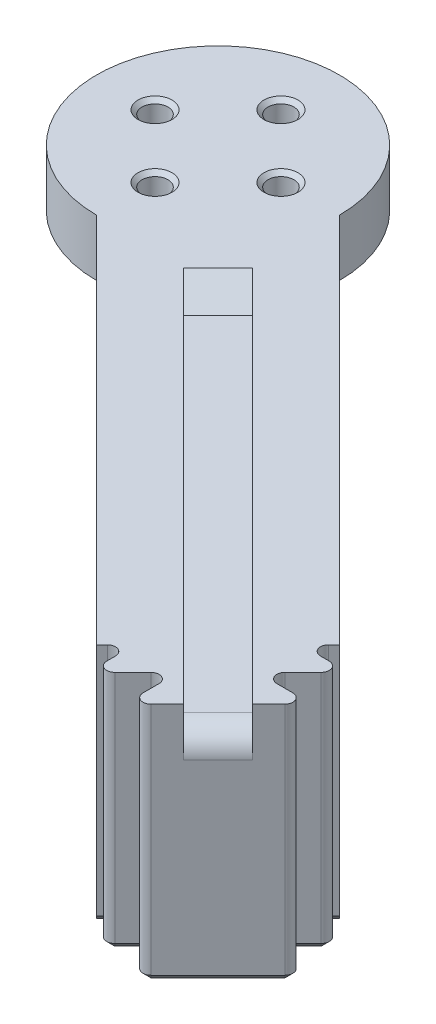
from build123d import *

# Parameters (mm, degrees)
BOSS_EXTRUDE1_DEPTH      = 10
SKETCH2_R                = 1.6
CUT_EXTRUDE1_DEPTH       = 10
BOSS_EXTRUDE4_DEPTH      = 1
BOSS_EXTRUDE5_DEPTH      = 21.213203436
BOSS_EXTRUDE6_DEPTH      = 30
FILLET3_R                = 1
CUT_EXTRUDE8_DEPTH       = 3
FILLET8_R                = 1
FILLET9_R                = 3
CHAMFER2_SIZE            = 3
CUT_EXTRUDE18_DEPTH      = 97.248328989
CUT_EXTRUDE18_DEPTH_BACK = 97.248328989
SKETCH21_W               = 30
SKETCH21_H               = 15.758887264
CHAMFER3_SIZE            = 3
CHAMFER4_SIZE            = 0.5
CHAMFER6_SIZE            = 1
SKETCH23_R               = 2
CUT_EXTRUDE19_DEPTH      = 3
CUT_EXTRUDE20_START      = -15
SKETCH24_R               = 2
CUT_EXTRUDE20_DEPTH      = 5
SKETCH25_R               = 3
CUT_EXTRUDE21_DEPTH      = 2
CUT_EXTRUDE22_DEPTH      = 94.615857044
CUT_EXTRUDE23_REACH      = 97.663
FILLET10_R               = 3
BOSS_EXTRUDE7_DEPTH      = 11.213203436
FILLET11_START           = -20
FILLET11_DEPTH           = 3.841689217
FILLET11_START_2         = 4.444783185
FILLET11_2_DEPTH         = 3.682043042
CHAMFER7_SIZE            = 1
FILLET12_R               = 3


with BuildPart() as part:
    # Sketch1 → Boss-Extrude1 (new body)
    with BuildSketch(Plane(origin=(0, 0, 0), x_dir=(1, 0, 0), z_dir=(0, 1, 0))):
        with BuildLine():
            Line((0, -15), (45.961940777, -60.961940777))
            Line((45.961940777, -60.961940777), (60.961940777, -45.961940777))
            Line((60.961940777, -45.961940777), (15, 0))
            ThreePointArc((15, 0), (-10.606601718, 10.606601718), (0, -15))
        make_face()
    extrude(amount=BOSS_EXTRUDE1_DEPTH)

    # Sketch2 → Cut-Extrude1 (cut)
    with BuildSketch(Plane(origin=(0, 10, 0), x_dir=(1, 0, 0), z_dir=(0, 1, 0))):
        with Locations(Location((-7.657178999, -0.123260765, 0), (0, 0, 270))):
            Circle(SKETCH2_R)
        with Locations(Location((0.120995594, 7.654913828, 0), (0, 0, 270))):
            Circle(SKETCH2_R)
        with Locations(Location((0.120995594, -7.901435358, 0), (0, 0, 270))):
            Circle(SKETCH2_R)
        with Locations(Location((7.899170187, -0.123260765, 0), (0, 0, 270))):
            Circle(SKETCH2_R)
    extrude(amount=-CUT_EXTRUDE1_DEPTH, mode=Mode.SUBTRACT)

    # Sketch4 → Boss-Extrude4 (add)
    with BuildSketch(Plane(origin=(0, 10, 0), x_dir=(1, 0, 0), z_dir=(0, 1, 0))):
        with BuildLine():
            ThreePointArc((17.783481901, -2.783481901), (17.94578884, -1.395945162), (18, 0))
            ThreePointArc((18, 0), (-13.676671273, 11.702506693), (2.783481901, -17.783481901))
            Line((2.783481901, -17.783481901), (0, -15))
            ThreePointArc((0, -15), (-10.606601718, 10.606601718), (15, 0))
            Line((15, 0), (17.783481901, -2.783481901))
        make_face()
    extrude(amount=BOSS_EXTRUDE4_DEPTH)


with BuildPart() as boss_extrude4_kept_piece:
    # of the separate pieces the step leaves, the one the design keeps (boss_extrude4_pieces_kept)
    add(part.part.solids().sort_by_distance((0, 0, 15))[0])

    # Sketch6 → Boss-Extrude5 (add)
    with BuildSketch(Plane(origin=(-7.5, 0, 7.5), x_dir=(0.7071067811865465, 0, 0.7071067811865486), z_dir=(-0.7071067811865486, 0, 0.7071067811865465))):
        Polygon((10.606601718, 0), (75.606601718, -30), (75.606601718, 0), align=None)
    extrude(amount=-BOSS_EXTRUDE5_DEPTH)

    # Sketch9 → Boss-Extrude6 (add)
    with BuildSketch(Plane(origin=(0, 10, 0), x_dir=(1, 0, 0), z_dir=(0, 1, 0))):
        Polygon((58.587332355, -48.336549199), (64.487332355, -48.336549199), (58.842440773, -53.981440781), (65.642440773, -53.981440781), (53.975178884, -65.64870267), (53.975178884, -58.84870267), (48.334284028, -64.489597526), (48.334284028, -58.589597526), align=None)
    extrude(amount=-BOSS_EXTRUDE6_DEPTH)

    # Fillet3
    fillet3_edges = [boss_extrude4_kept_piece.edges().sort_by_distance(p)[0] for p in [
        (64.487332355, -5, 48.336549199),
        (58.842440773, -5, 53.981440781),
        (65.642440773, -5, 53.981440781),
        (53.975178884, -5, 65.64870267),
        (53.975178884, -5, 58.84870267),
        (48.334284028, -5, 64.489597526),
    ]]
    fillet(fillet3_edges, radius=FILLET3_R)

    # Sketch14 → Cut-Extrude8 (cut)
    with BuildSketch(Plane(origin=(0, 10, 0), x_dir=(1, 0, 0), z_dir=(0, 1, 0))):
        Polygon((11.012361252, -15.255001908), (57.690620449, -61.933261105), (61.933261121, -57.690620434), (15.255367782, -11.012727095), align=None)
    extrude(amount=-CUT_EXTRUDE8_DEPTH, mode=Mode.SUBTRACT)

    # Fillet8
    fillet8_edges = [boss_extrude4_kept_piece.edges().sort_by_distance(p)[0] for p in [
        (48.334284028, -5, 58.589597526),
        (58.587332355, -5, 48.336549199),
    ]]
    fillet(fillet8_edges, radius=FILLET8_R)

    # Fillet9
    fillet9_edges = [boss_extrude4_kept_piece.edges().sort_by_distance(p)[0] for p in [
        (59.811940785, 7, 59.811940769),
    ]]
    fillet(fillet9_edges, radius=FILLET9_R)

    # Chamfer2
    chamfer2_edges = [boss_extrude4_kept_piece.edges().sort_by_distance(p)[0] for p in [
        (13.133864517, 7, 13.133864501),
    ]]
    chamfer(chamfer2_edges, length=CHAMFER2_SIZE - 0.0001)  # a hair under: the kernel refuses the full size

    # Sketch21 → Cut-Extrude18 (cut, two sides: drawn at the far end of the back side and taken through both)
    with BuildSketch(Plane(origin=(-7.5, 0, 7.5), x_dir=(0.7071067811865464, 0, 0.7071067811865487), z_dir=(-0.7071067811865487, 0, 0.7071067811865464)).offset(-CUT_EXTRUDE18_DEPTH_BACK)):
        with Locations((62.606601718, -27.879443632)):
            Rectangle(SKETCH21_W, SKETCH21_H)
    extrude(amount=CUT_EXTRUDE18_DEPTH + CUT_EXTRUDE18_DEPTH_BACK, mode=Mode.SUBTRACT)

    # Chamfer3
    # the kernel refuses this chamfer: 3 mm, written as the material it takes off along each edge
    with BuildSketch(Plane(origin=(0, 0, 0), x_dir=(0.7093247295722745, 0, 0.7048818539423608), z_dir=(-0.7048818539423608, 0, 0.7093247295722745))) as chamfer3_piece_1_section:
        Polygon((15 - CHAMFER3_SIZE, 0), (15, CHAMFER3_SIZE), (15, 0), align=None)
    chamfer3_piece_1 = revolve(axis=Axis((0, 0, 0), (0, 1, 0)), revolution_arc=359.64, mode=Mode.PRIVATE)
    chamfer3_piece_1 = split(chamfer3_piece_1, bisect_by=Plane(origin=(7.5, 0, -7.5), z_dir=(0.7071067811865488, 0, -0.7071067811865464)), keep=Keep.TOP, mode=Mode.PRIVATE)
    add(chamfer3_piece_1, mode=Mode.SUBTRACT)
    with BuildSketch(Plane(origin=(0, 0, 0), x_dir=(0.7093247295722745, 0, 0.7048818539423608), z_dir=(-0.7048818539423608, 0, 0.7093247295722745))) as chamfer3_piece_2_section:
        Polygon((15 - CHAMFER3_SIZE, 0), (15, CHAMFER3_SIZE), (15, 0), align=None)
    chamfer3_piece_2 = revolve(axis=Axis((0, 0, 0), (0, 1, 0)), revolution_arc=359.64, mode=Mode.PRIVATE)
    chamfer3_piece_2 = split(chamfer3_piece_2, bisect_by=Plane(origin=(1.317073171, 4.035682605, 1.317073171), z_dir=(-0.2963188789948765, -0.9079593845004517, -0.29631887899487735)), keep=Keep.TOP, mode=Mode.PRIVATE)
    add(chamfer3_piece_2, mode=Mode.SUBTRACT)
    with BuildSketch(Plane(origin=(0, 0, 0), x_dir=(0.7093247295722745, 0, 0.7048818539423608), z_dir=(-0.7048818539423608, 0, 0.7093247295722745))) as chamfer3_piece_3_section:
        Polygon((15 - CHAMFER3_SIZE, 0), (15, CHAMFER3_SIZE), (15, 0), align=None)
    chamfer3_piece_3 = revolve(axis=Axis((0, 0, 0), (0, 1, 0)), revolution_arc=359.64, mode=Mode.PRIVATE)
    chamfer3_piece_3 = split(chamfer3_piece_3, bisect_by=Plane(origin=(-7.5, 0, 7.5), z_dir=(-0.7071067811865487, 0, 0.7071067811865465)), keep=Keep.TOP, mode=Mode.PRIVATE)
    add(chamfer3_piece_3, mode=Mode.SUBTRACT)

    # Chamfer4
    chamfer4_edges = [boss_extrude4_kept_piece.edges().sort_by_distance(p)[0] for p in [
        (-7.657178999, 10, -1.476739235),
        (0.120995594, 10, -9.254913828),
        (0.120995594, 10, 6.301435358),
        (7.899170187, 10, -1.476739235),
    ]]
    chamfer(chamfer4_edges, length=CHAMFER4_SIZE)

    # Chamfer6
    chamfer6_edges = [boss_extrude4_kept_piece.edges().sort_by_distance(p)[0] for p in [
        (60.077666385, -20, 47.719232631),
        (61.537332355, -20, 48.336549199),
        (62.996998325, -20, 48.953865767),
        (61.664886564, -20, 51.15899499),
        (60.332774803, -20, 53.364124213),
        (62.242440773, -20, 53.981440781),
        (64.152106744, -20, 54.598757348),
        (59.808809829, -20, 59.815071726),
        (54.592495451, -20, 64.158368641),
        (53.975178884, -20, 62.24870267),
        (53.357862316, -20, 60.3390367),
        (51.154731456, -20, 61.669150098),
        (48.951600596, -20, 62.999263496),
        (48.334284028, -20, 61.539597526),
        (47.71696746, -20, 60.079931556),
        (46.294559012, -20, 60.629322542),
    ]]
    chamfer(chamfer6_edges, length=CHAMFER6_SIZE)

    # Sketch23 → Cut-Extrude19 (cut)
    with BuildSketch(Plane(origin=(7.5, 0, -7.5), x_dir=(-0.7071067811865464, 0, -0.7071067811865487), z_dir=(0.7071067811865487, 0, -0.7071067811865464))):
        with Locations((-14.106601718, 7)):
            Circle(SKETCH23_R)
    extrude(amount=-CUT_EXTRUDE19_DEPTH, mode=Mode.SUBTRACT)

    # Sketch24 → Cut-Extrude20 (cut)
    with BuildSketch(Plane(origin=(5.378679656, 0, -5.378679656), x_dir=(-0.7071067811865464, 0, -0.7071067811865487), z_dir=(0.7071067811865487, 0, -0.7071067811865464)).offset(CUT_EXTRUDE20_START)):
        with Locations((-14.106601718, 7)):
            Circle(SKETCH24_R)
    extrude(amount=-CUT_EXTRUDE20_DEPTH, mode=Mode.SUBTRACT)

    # Sketch25 → Cut-Extrude21 (cut)
    with BuildSketch(Plane.XZ):
        with Locations(Location((0.120995594, 7.901435358, 0), (0, 0, 270))):
            Circle(SKETCH25_R)
        with Locations(Location((7.899170187, 0.123260765, 0), (0, 0, 270))):
            Circle(SKETCH25_R)
        with Locations(Location((0.120995594, -7.654913828, 0), (0, 0, 270))):
            Circle(SKETCH25_R)
        with Locations(Location((-7.657178999, 0.123260765, 0), (0, 0, 270))):
            Circle(SKETCH25_R)
    extrude(amount=-CUT_EXTRUDE21_DEPTH, mode=Mode.SUBTRACT)

    # Sketch26 → Cut-Extrude22 (cut, through all)
    with BuildSketch(Plane(origin=(7.5, 0, -7.5), x_dir=(-0.7071067811865464, 0, -0.7071067811865487), z_dir=(0.7071067811865487, 0, -0.7071067811865464))):
        with BuildLine():
            Line((-72.52094378, 3.760888014), (-72.52094378, -16.158310783))
            Line((-72.52094378, -16.158310783), (-53.43246618, -16.158310783))
            Line((-53.43246618, -16.158310783), (-70.756162227, 4.405177682))
            ThreePointArc((-70.756162227, 4.405177682), (-71.863885792, 4.70024459), (-72.52094378, 3.760888014))
        make_face()
        Polygon((-67.290692101, 6.5), (-50.224568487, 6.5), (-37.649956854, -8.426253646), (-49.938151068, -14.097727899), align=None)
        Polygon((-17.826030316, 6.5), (-17.826030316, 0.72325091), (-33.883996295, -6.688118003), (-44.994316808, 6.5), align=None)
    extrude(amount=-CUT_EXTRUDE22_DEPTH, mode=Mode.SUBTRACT)

    # Cut-Extrude23: up to this face of the body (flat: up to its plane)
    cut_extrude23_end = Plane(boss_extrude4_kept_piece.part.faces().sort_by_distance((22.210346724, 6.5, 22.210346724))[0])
    # Sketch27 → Cut-Extrude23 (cut, up to the picked face)
    with BuildSketch(Plane.XZ.offset(20), mode=Mode.PRIVATE) as cut_extrude23_sk1:
        Polygon((47.315585031, 55.244517219), (8.640440824, 16.569373012), (16.569373012, 8.640440824), (55.244517219, 47.315585031), align=None)
    cut_extrude23_tool1 = split(extrude(cut_extrude23_sk1.sketch, amount=-CUT_EXTRUDE23_REACH, mode=Mode.PRIVATE), bisect_by=cut_extrude23_end, keep=Keep.BOTH, mode=Mode.PRIVATE)
    add(cut_extrude23_tool1.solids().sort_by(Axis((31.942479, -20, 31.942479), (0, 1, 0)))[0], mode=Mode.SUBTRACT)

    # Fillet10
    fillet10_edges = [boss_extrude4_kept_piece.edges().sort_by_distance(p)[0] for p in [
        (29.579372213, -14.097727899, 41.043838307),
        (41.849471648, 6.5, 53.313937743),
        (29.781899912, 6.5, 41.246366006),
        (20.890306756, -8.426253646, 32.35477285),
        (26.083553483, 6.5, 37.548019577),
        (12.604906918, 6.5, 12.604906918),
        (6.872673871, 0.72325091, 18.337139965),
        (18.227370507, -6.688118003, 29.691836601),
        (32.050226125, -16.158310783, 43.514692219),
        (45.547818078, -16.158310783, 57.012284172),
        (41.043838307, -14.097727899, 29.579372213),
        (32.35477285, -8.426253646, 20.890306756),
        (41.246366006, 6.5, 29.781899912),
        (53.313937743, 6.5, 41.849471648),
        (37.548019577, 6.5, 26.083553483),
        (29.691836601, -6.688118003, 18.227370507),
        (18.337139965, 0.72325091, 6.872673871),
        (43.514692219, -16.158310783, 32.050226125),
        (57.012284172, -16.158310783, 45.547818078),
        (16.569373012, -1.304396529, 8.640440824),
        (8.640440824, -1.304396529, 16.569373012),
        (55.244517219, -18.079155391, 47.315585031),
        (47.315585031, -18.079155391, 55.244517219),
    ]]
    fillet(fillet10_edges, radius=FILLET10_R)

    # Sketch29 → Boss-Extrude7 (add)
    with BuildSketch(Plane(origin=(-3.964466094, 0, 3.964466094), x_dir=(-0.7071067811865476, 0, -0.7071067811865476), z_dir=(0.7071067811865476, 0, -0.7071067811865476))):
        Polygon((-31.802531819, -5.727442092), (-41.221502204, -10.074659192), (-39.678511957, -13.417804726), (-30.259541573, -9.070587625), align=None)
        Polygon((-59.882502779, -16.158310783), (-59.882502779, -20), (-53.939935051, -20), (-46.161766217, -16.410075922), (-47.704756463, -13.066930389), (-54.598845583, -16.287640164), align=None)
    extrude(amount=BOSS_EXTRUDE7_DEPTH)

    # Fillet11: read off the stored shape, not the designer's step
    # Fillet11 outline → Fillet11 (add)
    with BuildSketch(Plane(origin=(0, 0, 0), x_dir=(1, 0, 0), z_dir=(0, 1, 0)).offset(FILLET11_START)):
        with BuildLine():
            ThreePointArc((40.500178039, -48.429110227), (39.621498382, -46.307789883), (40.500178039, -44.18646954))
            Line((40.500178039, -44.18646954), (38.378857695, -46.307789883))
            Line((38.378857695, -46.307789883), (40.500178039, -48.429110227))
        make_face()
        with BuildLine():
            ThreePointArc((44.18646954, -40.500178039), (46.307789883, -39.621498382), (48.429110227, -40.500178039))
            Line((48.429110227, -40.500178039), (46.307789883, -38.378857695))
            Line((46.307789883, -38.378857695), (44.18646954, -40.500178039))
        make_face()
    extrude(amount=FILLET11_DEPTH)

    # Fillet11 2 outline → Fillet11 2 (add)
    with BuildSketch(Plane(origin=(0, 0, 0), x_dir=(0.9550890649312359, -0.28169677244437874, -0.09193370678482153), z_dir=(0.296318878994872, 0.907959384500455, 0.296318878994872)).offset(FILLET11_START_2)):
        with BuildLine():
            Line((16.872968573, -26.92389706), (19.094039279, -24.907255069))
            ThreePointArc((19.094039279, -24.907255069), (16.932844357, -25.682699747), (14.856326582, -24.702826354))
            Line((14.856326582, -24.702826354), (16.872968573, -26.92389706))
        make_face()
        with BuildLine():
            ThreePointArc((23.158099138, -17.165154053), (23.933543817, -19.326348974), (22.953670424, -21.40286675))
            Line((22.953670424, -21.40286675), (25.174741129, -19.386224759))
            Line((25.174741129, -19.386224759), (23.158099138, -17.165154053))
        make_face()
        with BuildLine():
            Line((36.9480629, -32.353018177), (34.931420909, -30.131947471))
            ThreePointArc((34.931420909, -30.131947471), (35.706865588, -32.293142392), (34.726992195, -34.369660168))
            Line((34.726992195, -34.369660168), (36.9480629, -32.353018177))
        make_face()
        with BuildLine():
            ThreePointArc((29.927070157, -29.083165949), (32.088265078, -28.30772127), (34.164782854, -29.287594663))
            Line((34.164782854, -29.287594663), (32.148140863, -27.066523958))
            Line((32.148140863, -27.066523958), (29.927070157, -29.083165949))
        make_face()
        with BuildLine():
            Line((28.646290344, -39.890690478), (30.86736105, -37.874048487))
            ThreePointArc((30.86736105, -37.874048487), (28.706166128, -38.649493166), (26.629648353, -37.669619772))
            Line((26.629648353, -37.669619772), (28.646290344, -39.890690478))
        make_face()
        with BuildLine():
            ThreePointArc((25.863010297, -36.825266964), (25.087565618, -34.664072042), (26.067439012, -32.587554267))
            Line((26.067439012, -32.587554267), (23.846368306, -34.604196258))
            Line((23.846368306, -34.604196258), (25.863010297, -36.825266964))
        make_face()
    extrude(amount=FILLET11_2_DEPTH)

    # Chamfer7
    chamfer7_edges = [boss_extrude4_kept_piece.edges().sort_by_distance(p)[0] for p in [
        (43.780051125, -4.698711384, 58.780051125),
        (43.315440966, 4.70024459, 58.315440966),
        (58.315440966, 4.70024459, 43.315440966),
        (58.780051125, -4.698711384, 43.780051125),
        (10.663966871, -2.905225081, 25.663966871),
        (19.439617499, -1.685589971, 34.439617499),
        (25.663966871, -2.905225081, 10.663966871),
        (34.439617499, -1.685589971, 19.439617499),
        (23.995334281, -11.606794587, 38.995334281),
        (32.998577435, -5.390394919, 47.998577435),
        (38.995334281, -11.606794587, 23.995334281),
        (47.998577435, -5.390394919, 32.998577435),
        (39.146527515, 0.007478486, 24.146527515),
        (24.146527515, 0.007478486, 39.146527515),
        (37.876569622, -3.410132048, 52.876569622),
        (38.251027285, -16.158310783, 53.251027285),
        (52.876569622, -3.410132048, 37.876569622),
        (53.251027285, -16.158310783, 38.251027285),
        (13.490574587, 6.5, 28.490574587),
        (28.490574587, 6.5, 13.490574587),
        (47.260814032, 6.5, 32.260814032),
        (32.260814032, 6.5, 47.260814032),
        (20.104906918, 3.071374039, 5.104906918),
        (5.104906918, 3.071374039, 20.104906918),
        (16.340789103, -5.933691523, 31.340789103),
        (31.340789103, -5.933691523, 16.340789103),
        (27.692790809, -13.343301418, 42.692790809),
        (42.692790809, -13.343301418, 27.692790809),
        (35.466375233, -8.002972986, 20.466375233),
        (20.466375233, -8.002972986, 35.466375233),
        (32.919875907, -14.42349713, 47.919875907),
        (47.919875907, -14.42349713, 32.919875907),
        (43.158730781, -15.279631127, 58.158730781),
        (58.158730781, -15.279631127, 43.158730781),
        (37.44428796, 4.765186347, 52.44428796),
        (52.44428796, 4.765186347, 37.44428796),
        (36.678369794, 4.765186347, 21.678369794),
        (21.678369794, 4.765186347, 36.678369794),
        (28.10616614, 6.220166081, 43.10616614),
        (43.10616614, 6.220166081, 28.10616614),
        (20.726227262, 5.621320344, 5.726227262),
        (5.726227262, 5.621320344, 20.726227262),
        (20.439363837, 1.025887478, 5.439363837),
        (5.439363837, 1.025887478, 20.439363837),
    ]]
    chamfer(chamfer7_edges, length=CHAMFER7_SIZE)

    # Fillet12
    fillet12_edges = [boss_extrude4_kept_piece.edges().sort_by_distance(p)[0] for p in [
        (35.842321043, 6.5, 27.913388855),
        (51.114911695, 6.5, 43.185979507),
        (27.913388855, 6.5, 35.842321043),
        (43.185979507, 6.5, 51.114911695),
    ]]
    fillet(fillet12_edges, radius=FILLET12_R - 0.0001)  # a hair under: the kernel refuses the full size


solid = boss_extrude4_kept_piece.part
